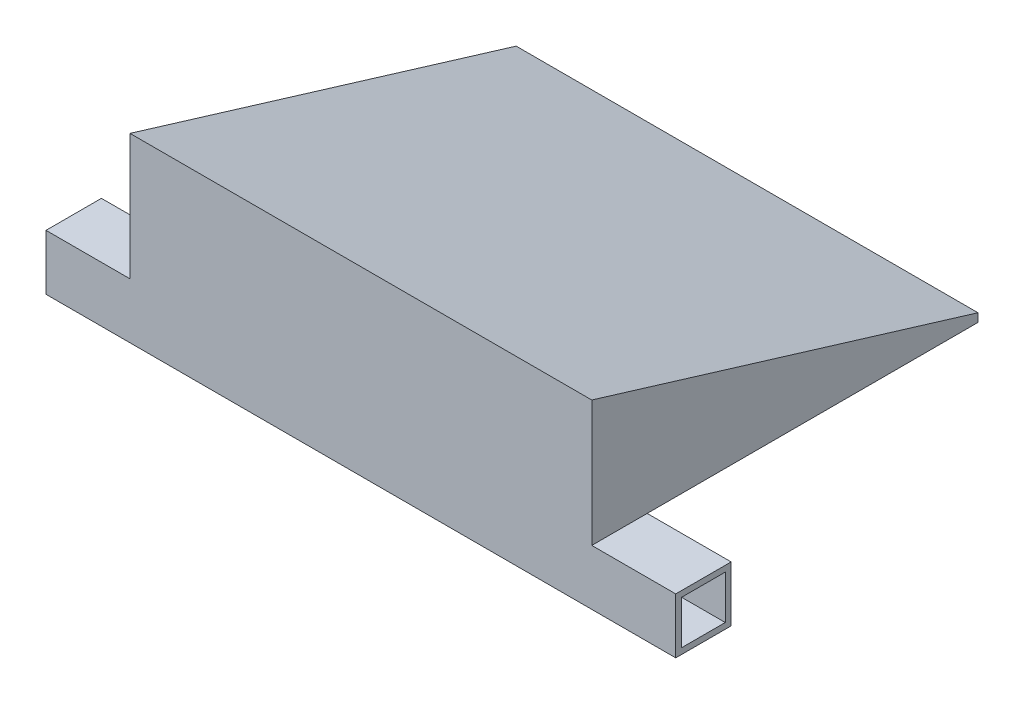
from build123d import *

# Parameters (mm, degrees)
CROQUIS6_W              = 375
CROQUIS6_H              = 33
SALIENTE_EXTRUIR4_DEPTH = 33
CROQUIS7_W              = 275
CROQUIS7_H              = 230
SALIENTE_EXTRUIR5_DEPTH = 75
CHAFL_N2_START          = 77.927326738
CHAFL_N2_OUTLINE_W      = 275
CHAFL_N2_OUTLINE_H      = 245
CHAFL_N2_DEPTH          = 68.072673262
VACIADO4_T              = -3.5


with BuildPart() as part:
    # Croquis6 → Saliente-Extruir4 (new body)
    with BuildSketch(Plane.XY):
        Rectangle(CROQUIS6_W, CROQUIS6_H)
    extrude(amount=SALIENTE_EXTRUIR4_DEPTH)

    # Croquis7 → Saliente-Extruir5 (add)
    with BuildSketch(Plane(origin=(0, 16.5, 0), x_dir=(1, 0, 0), z_dir=(0, 1, 0))):
        with Locations((6.494e-05, 82)):
            Rectangle(CROQUIS7_W, CROQUIS7_H)
    extrude(amount=SALIENTE_EXTRUIR5_DEPTH)

    # Chaflán2: read off the stored shape, not the designer's step
    # Chaflán2 outline → Chaflán2 (cut)
    with BuildSketch(Plane(origin=(0, 0, 0), x_dir=(1, 0, 0), z_dir=(0, 0.9566738804288585, -0.2911616157826961)).offset(CHAFL_N2_START)):
        with Locations((6.494e-05, 62.5)):
            Rectangle(CHAFL_N2_OUTLINE_W, CHAFL_N2_OUTLINE_H)
    extrude(amount=CHAFL_N2_DEPTH, mode=Mode.SUBTRACT)

    # Vaciado4
    vaciado4_openings = [part.faces().sort_by_distance(p)[0] for p in [
        (-187.5, 0, 16.5),
        (187.5, 0, 16.5),
    ]]
    offset(amount=VACIADO4_T, openings=vaciado4_openings, kind=Kind.INTERSECTION)


solid = part.part
